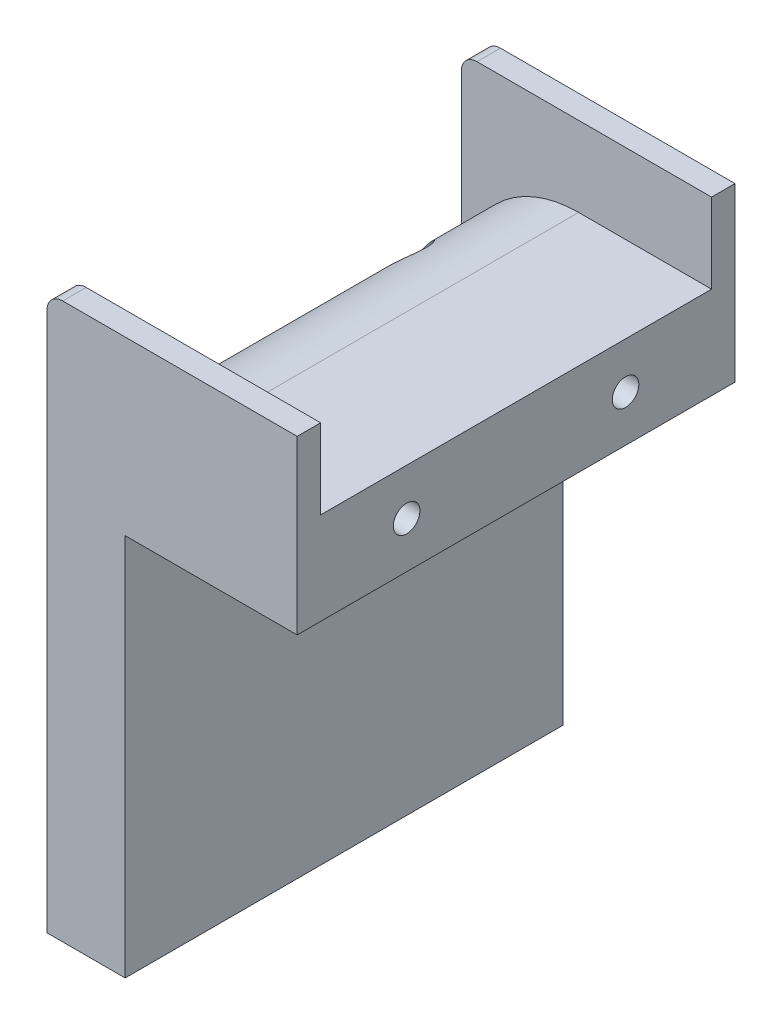
from build123d import *

# Parameters (mm, degrees)
BOSS_EXTRUDE1_DEPTH                                 = 28
CBORE_FOR_M3_HEX_SOCKET_HEAD_CAP_SCREW1_D           = 3.4
CBORE_FOR_M3_HEX_SOCKET_HEAD_CAP_SCREW1_CBORE_D     = 6.5
CBORE_FOR_M3_HEX_SOCKET_HEAD_CAP_SCREW1_CBORE_DEPTH = 18.4
SKETCH5_W                                           = 3
SKETCH5_H                                           = 10.2
BOSS_EXTRUDE3_DEPTH                                 = 32
FILLET1_R                                           = 15
CUT_SWEEP1_START                                    = 17.5
CUT_SWEEP1_DEPTH                                    = 5
FILLET2_R                                           = 2


# Read off the part's stored shape, not the designer's step: Cut-Sweep1
with BuildPart() as part:
    # Sketch1 → Boss-Extrude1 (new, symmetric)
    with BuildSketch(Plane.XY):
        Polygon((0, 0), (0, 60.8), (32, 60.8), (32, 49), (10, 49), (10, 0), align=None)
    extrude(amount=BOSS_EXTRUDE1_DEPTH, both=True)

    # CBORE for M3 Hex Socket Head Cap Screw1 (through all)
    with Locations(Plane.ZY):
        with Locations((14, 54.9), (-14, 54.9)):
            CounterBoreHole(CBORE_FOR_M3_HEX_SOCKET_HEAD_CAP_SCREW1_D / 2, CBORE_FOR_M3_HEX_SOCKET_HEAD_CAP_SCREW1_CBORE_D / 2, CBORE_FOR_M3_HEX_SOCKET_HEAD_CAP_SCREW1_CBORE_DEPTH)

    # Sketch5 → Boss-Extrude3 (add)
    with BuildSketch(Plane(origin=(32, 0, 0), x_dir=(0, 0, -1), z_dir=(1, 0, 0))):
        with Locations((-26.5, 65.9)):
            Rectangle(SKETCH5_W, SKETCH5_H)
        with Locations((26.5, 65.9)):
            Rectangle(SKETCH5_W, SKETCH5_H)
    extrude(amount=-BOSS_EXTRUDE3_DEPTH)

    # Fillet1
    # the kernel refuses this fillet: 15 mm, written as the material it takes off along each edge
    with BuildSketch(Plane(origin=(0, 60.8, 25), x_dir=(0, -1, 0), z_dir=(0, 0, -1))) as fillet1_piece_1:
        with BuildLine():
            CenterArc((FILLET1_R, -FILLET1_R), FILLET1_R, 90, 90)
            Line((0, -FILLET1_R), (0, 0))
            Line((0, 0), (FILLET1_R, 0))
        make_face()
    extrude(amount=50, mode=Mode.SUBTRACT)

    # Cut-Sweep1 outline → Cut-Sweep1 (cut)
    with BuildSketch(Plane(origin=(0, 0, 0), x_dir=(1, 0, 0), z_dir=(0, 1, 0)).offset(CUT_SWEEP1_START)):
        with BuildLine():
            add(Edge.make_bspline(
                [(0, 21.25), (0.24543691, 21.25), (0.503005998, 21.185067302), (1.142972539, 20.803030792), (1.513644961, 20.479106412), (2.661593441, 19.052618916), (3.454291906, 17.504082361), (4.780601567, 13.525153377), (5.323721278, 11.098345132), (6.057965891, 5.780475225), (6.25, 2.890701574), (6.25, -2.890701574), (6.057965891, -5.780475225), (5.323721278, -11.098345132), (4.780601567, -13.525153377), (3.454291906, -17.504082361), (2.661593441, -19.052618916), (1.513644961, -20.479106412), (1.142972539, -20.803030792), (0.503005998, -21.185067302), (0.24543691, -21.25), (0, -21.25)],
                knots=[0.75, 0.75, 0.75, 0.75, 0.78125, 0.78125, 0.8125, 0.8125, 0.875, 0.875, 0.9375, 0.9375, 1, 1, 1.0625, 1.0625, 1.125, 1.125, 1.1875, 1.1875, 1.21875, 1.21875, 1.25, 1.25, 1.25, 1.25], degree=3))
            Line((0, -21.25), (0, -23.75))
            add(Edge.make_bspline(
                [(0, -23.75), (0.736310661, -23.75), (1.461325008, -23.524563287), (2.747539499, -22.756740545), (3.319589998, -22.222568191), (4.892691098, -20.267768767), (5.763908978, -18.480925296), (7.214400985, -14.129449273), (7.783074584, -11.564508722), (8.551624223, -5.998179833), (8.75, -2.999784652), (8.75, 2.999784652), (8.551624223, 5.998179833), (7.783074584, 11.564508722), (7.214400985, 14.129449273), (5.763908978, 18.480925296), (4.892691098, 20.267768767), (3.319589998, 22.222568191), (2.747539499, 22.756740545), (1.461325008, 23.524563287), (0.736310661, 23.75), (0, 23.75)],
                knots=[0, 0, 0, 0, 0.03125, 0.03125, 0.0625, 0.0625, 0.125, 0.125, 0.1875, 0.1875, 0.25, 0.25, 0.3125, 0.3125, 0.375, 0.375, 0.4375, 0.4375, 0.46875, 0.46875, 0.5, 0.5, 0.5, 0.5], degree=3))
            Line((0, 23.75), (0, 21.25))
        make_face()
    extrude(amount=CUT_SWEEP1_DEPTH, mode=Mode.SUBTRACT)

    # Fillet2
    fillet2_edges = [part.edges().sort_by_distance(p)[0] for p in [
        (0, 71, 26.5),
        (0, 71, -26.5),
    ]]
    fillet(fillet2_edges, radius=FILLET2_R)


solid = part.part
